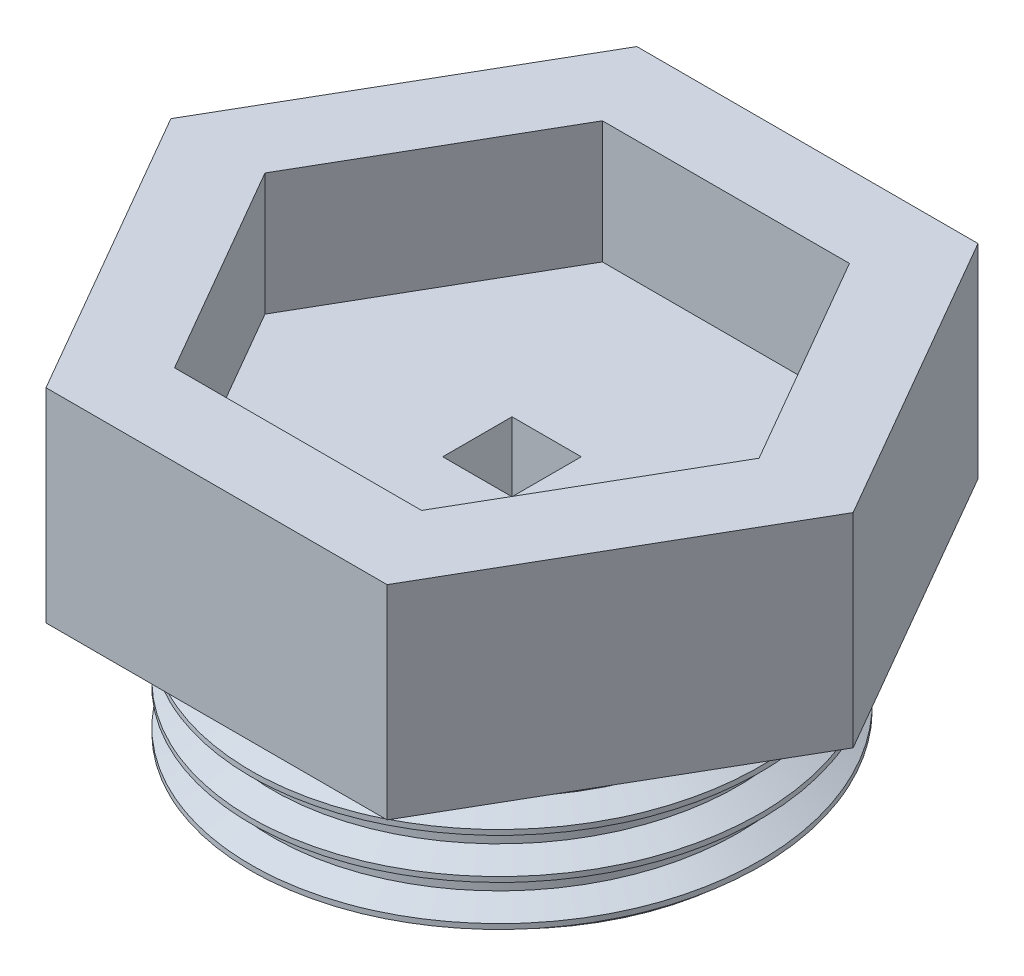
from build123d import *

# Parameters (mm, degrees)
SKETCH1_R               = 6.25
BOSS_EXTRUDE1_DEPTH     = 4
THREAD1_PITCH           = 1
BOSS_EXTRUDE2_DEPTH     = 5
CUT_EXTRUDE1_DEPTH      = 3
CUT_EXTRUDE2_DEPTH      = 13.59546881
CUT_EXTRUDE2_DEPTH_BACK = 13.59546881
SKETCH6_W               = 1.7
SKETCH6_H               = 1.7


with BuildPart() as part:
    # Sketch1 → Boss-Extrude1 (new body)
    with BuildSketch(Plane(origin=(0, 0, 0), x_dir=(1, 0, 0), z_dir=(0, 1, 0))):
        with Locations(Location((0, 0, 0), (0, 0, 270))):
            Circle(SKETCH1_R)
    extrude(amount=BOSS_EXTRUDE1_DEPTH)

    # Thread1: the profile of Thread Profile1 profile screwed along a right-hand helix of 4 turns, 8 arcs to a turn; built about Z, then put on its axis
    thread1_z = Axis((0, 0, 0), (0, 0, 1))
    thread1_corners = [(6.2503, 0, -0.000173205), (6.2503, 0, 0.875173202), (5.708734125, 0, 0.562499999), (5.708734125, 0, 0.312499999)]
    with BuildLine(mode=Mode.PRIVATE) as thread1_profile:
        Line(thread1_corners[0], thread1_corners[1])
        Line(thread1_corners[1], thread1_corners[2])
        Line(thread1_corners[2], thread1_corners[3])
        Line(thread1_corners[3], thread1_corners[0])
    thread1_cap = Face(thread1_profile.wire())
    thread1_turn_angles = [0, 22.5, 45, 67.5, 90, 112.5, 135, 157.5, 180, 202.5, 225, 247.5, 270, 292.5, 315, 337.5, 360]
    thread1_turn_weights = [1, 0.9238795325112867, 1, 0.9238795325112867, 1, 0.9238795325112867, 1, 0.9238795325112867, 1, 0.9238795325112867, 1, 0.9238795325112867, 1, 0.9238795325112867, 1, 0.9238795325112867, 1]
    thread1_turn_rails = [Edge.make_bspline([Vector(p[0], p[1], 0).rotate(thread1_z, thread1_turn_angles[k]) / thread1_turn_weights[k] + Vector(0, 0, p[2] + THREAD1_PITCH * thread1_turn_angles[k] / 360) for k in range(17)], [0, 0, 0, 1, 1, 2, 2, 3, 3, 4, 4, 5, 5, 6, 6, 7, 7, 8, 8, 8], 2, thread1_turn_weights) for p in thread1_corners]
    thread1_turn_sides = [Face.make_surface_from_curves(thread1_turn_rails[p[0]], thread1_turn_rails[p[1]]) for p in [(0, 1), (1, 2), (2, 3), (3, 0)]]
    thread1 = Plane(origin=(0, 4, 0), x_dir=(-1, 0, 0), z_dir=(0, -1, 0)) * Solid(Shell([*[p.moved(Location((0, 0, THREAD1_PITCH * i))) for i in range(4) for p in thread1_turn_sides], thread1_cap, thread1_cap.rotate(thread1_z, 1440).moved(Location((0, 0, THREAD1_PITCH * 1440 / 360)))]))
    add(thread1, mode=Mode.SUBTRACT)

    # Sketch4 → Boss-Extrude2 (add)
    with BuildSketch(Plane(origin=(0, 4, 0), x_dir=(1, 0, 0), z_dir=(0, 1, 0))):
        Polygon((8.371578903, 0), (4.185789452, 7.25), (-4.185789452, 7.25), (-8.371578903, 0), (-4.185789452, -7.25), (4.185789452, -7.25), align=None)
    extrude(amount=BOSS_EXTRUDE2_DEPTH)

    # Sketch5 → Cut-Extrude1 (cut)
    with BuildSketch(Plane(origin=(0, 9, 0), x_dir=(1, 0, 0), z_dir=(0, 1, 0))):
        Polygon((3.031088913, 5.25), (-3.031088913, 5.25), (-6.062177826, 0), (-3.031088913, -5.25), (3.031088913, -5.25), (6.062177826, 0), align=None)
    extrude(amount=-CUT_EXTRUDE1_DEPTH, mode=Mode.SUBTRACT)

    # Sketch6 → Cut-Extrude2 (cut, two sides: drawn at the far end of the back side and taken through both)
    with BuildSketch(Plane(origin=(0, 6, 0), x_dir=(1, 0, 0), z_dir=(0, 1, 0)).offset(-CUT_EXTRUDE2_DEPTH_BACK)):
        Rectangle(SKETCH6_W, SKETCH6_H)
    extrude(amount=CUT_EXTRUDE2_DEPTH + CUT_EXTRUDE2_DEPTH_BACK, mode=Mode.SUBTRACT)


solid = part.part
